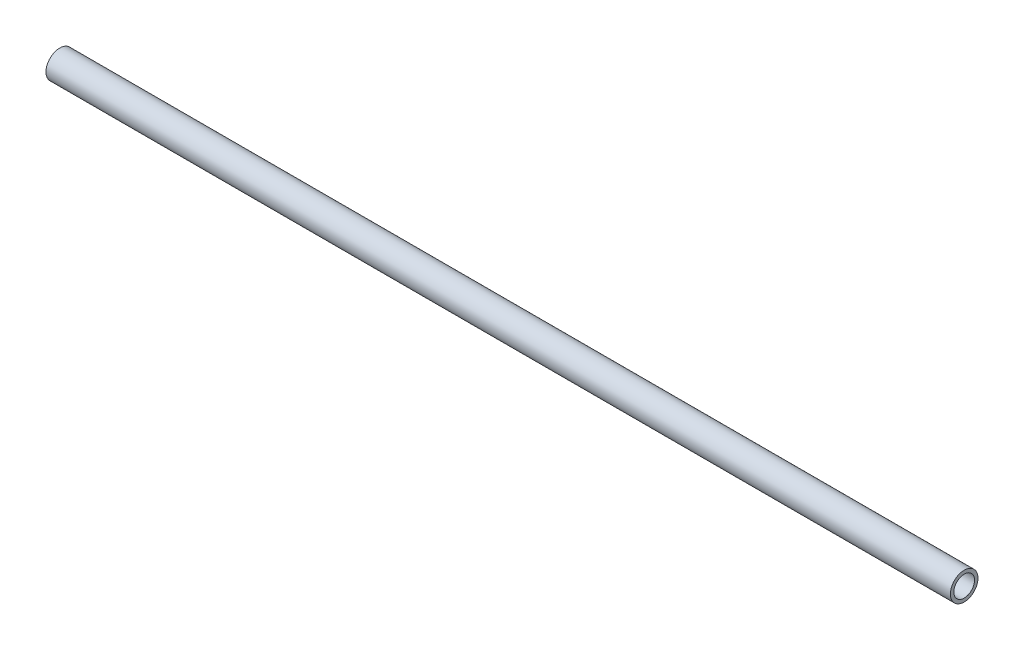
from build123d import *

# Parameters (mm, degrees)
SKETCH1_R           = 4
SKETCH1_R_2         = 3
BOSS_EXTRUDE1_DEPTH = 262


with BuildPart() as part:
    # Sketch1 → Boss-Extrude1 (new body)
    with BuildSketch(Plane(origin=(0, 0, 0), x_dir=(0, 0, -1), z_dir=(1, 0, 0))):
        Circle(SKETCH1_R)
        Circle(SKETCH1_R_2, mode=Mode.SUBTRACT)
    extrude(amount=BOSS_EXTRUDE1_DEPTH)


solid = part.part
